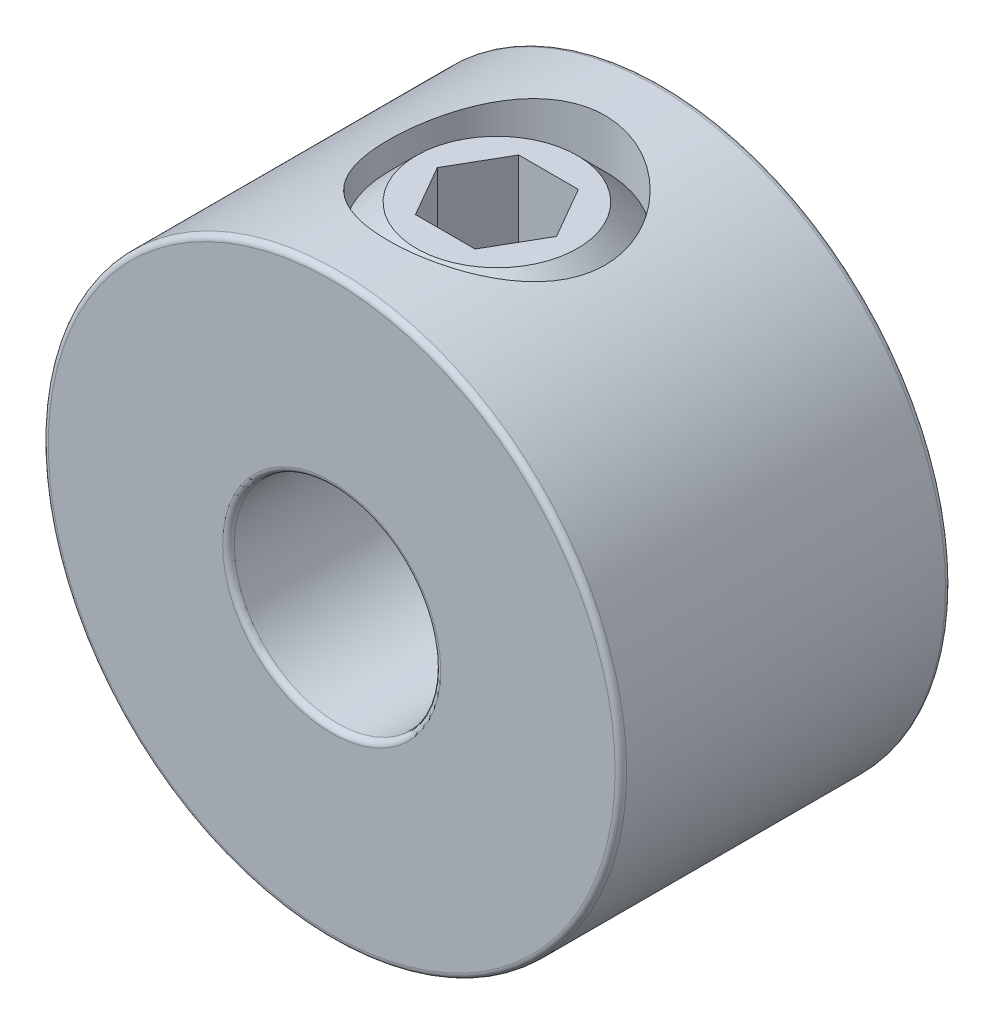
from build123d import *

# Parameters (mm, degrees)
SKETCH1_R          = 5.55625
SKETCH1_R_2        = 1.984375
EXTRUDE1_DEPTH     = 3.175
SKETCH2_R          = 2.0828
CUT_EXTRUDE1_DEPTH = 48.266462906
FILLET1_R          = 0.111125
CUT_EXTRUDE2_DEPTH = 1.984375


with BuildPart() as part:
    # Sketch1 → Extrude1 (new, symmetric)
    with BuildSketch(Plane.XY):
        Circle(SKETCH1_R)
        Circle(SKETCH1_R_2, mode=Mode.SUBTRACT)
    extrude(amount=EXTRUDE1_DEPTH, both=True)

    # Sketch2 → Cut-Extrude1 (cut, through all)
    with BuildSketch(Plane(origin=(41.275, 0, 0), x_dir=(0, 0, -1), z_dir=(0, -1, 0))):
        with Locations((0, -41.275)):
            Circle(SKETCH2_R)
    extrude(amount=-CUT_EXTRUDE1_DEPTH, mode=Mode.SUBTRACT)

    # Fillet1
    fillet1_edges = [part.edges().sort_by_distance(p)[0] for p in [
        (-1.984375, 0, -3.175),
        (-1.984375, 0, 3.175),
        (-5.55625, 0, -3.175),
        (-5.55625, 0, 3.175),
    ]]
    fillet(fillet1_edges, radius=FILLET1_R)


with BuildPart() as body_2:
    # Sketch3 → Revolve1 (revolve)
    with BuildSketch(Plane.XY):
        Polygon((-1.547302537, 1.984375), (-0.642596955, 1.984375), (0, 2.626971955), (0, 5.159375), (-1.547302537, 5.159375), (-2.0828, 4.623877537), (-2.0828, 2.519872463), align=None)
    revolve(axis=Axis((0, 1.984375, 0), (0, -1, 0)))

    # Sketch4 → Cut-Extrude2 (cut)
    with BuildSketch(Plane(origin=(3.3734375, 5.159375, 0), x_dir=(0, 0, -1), z_dir=(0, -1, 0))):
        Polygon((0, -2.22775806), (-0.9921875, -2.80059778), (-0.9921875, -3.94627722), (0, -4.51911694), (0.9921875, -3.94627722), (0.9921875, -2.80059778), align=None)
    extrude(amount=CUT_EXTRUDE2_DEPTH, mode=Mode.SUBTRACT)


solid = Compound([part.part, body_2.part])
